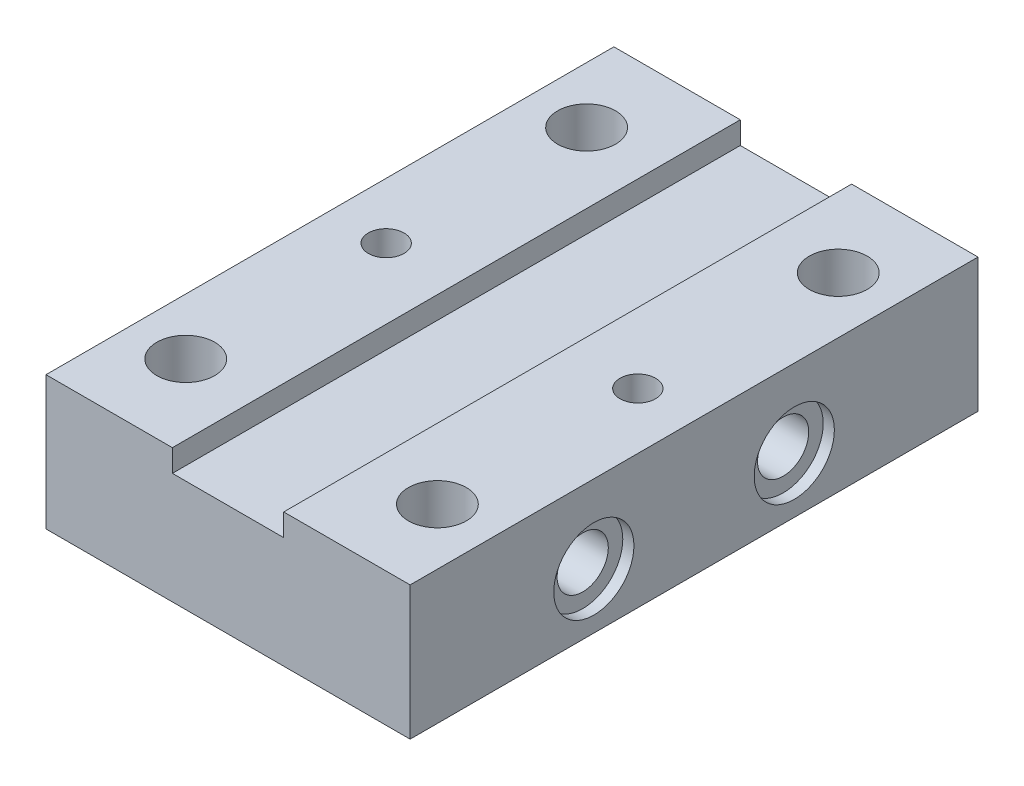
from build123d import *

# Parameters (mm, degrees)
SKETCH_1_W          = 32.7
SKETCH_1_H          = 51
EXTRUDE_1_DEPTH     = 12
SKETCH_2_R          = 2.6
SKETCH_2_R_2        = 1.6
CUT_EXTRUDE_1_DEPTH = 33.581781719
SKETCH_3_W          = 10
SKETCH_3_H          = 2
CUT_EXTRUDE_2_DEPTH = 55.884628996


# Read off the part's stored shape, not the designer's step: 高级异型孔1
with BuildPart() as part:
    # 草图1 → 凸台-拉伸1 (new body)
    with BuildSketch(Plane(origin=(0, 0, 0), x_dir=(1, 0, 0), z_dir=(0, 1, 0))):
        Rectangle(SKETCH_1_W, SKETCH_1_H)
    extrude(amount=EXTRUDE_1_DEPTH)

    # 草图2 → 切除-拉伸1 (cut, through all)
    with BuildSketch(Plane(origin=(0, 12, 0), x_dir=(1, 0, 0), z_dir=(0, 1, 0))):
        with Locations(Location((-11.3, 18, 0), (0, 0, 270))):
            Circle(SKETCH_2_R)
        with Locations(Location((11.3, 18, 0), (0, 0, 90))):
            Circle(SKETCH_2_R)
        with Locations(Location((11.3, -18, 0), (0, 0, 270))):
            Circle(SKETCH_2_R)
        with Locations(Location((-11.3, -18, 0), (0, 0, 90))):
            Circle(SKETCH_2_R)
        with Locations(Location((11.3, 0, 0), (0, 0, 270))):
            Circle(SKETCH_2_R_2)
        with Locations(Location((-11.3, 0, 0), (0, 0, 90))):
            Circle(SKETCH_2_R_2)
    extrude(amount=-CUT_EXTRUDE_1_DEPTH, mode=Mode.SUBTRACT)

    # 草图3 → 切除-拉伸2 (cut, through all)
    with BuildSketch(Plane.XY.offset(25.5)):
        with Locations((0, 11)):
            Rectangle(SKETCH_3_W, SKETCH_3_H)
    extrude(amount=-CUT_EXTRUDE_2_DEPTH, mode=Mode.SUBTRACT)

    # 高级异型孔1 outline → 高级异型孔1 (revolve, cut)
    with BuildSketch(Plane(origin=(0, 5, 9), x_dir=(0, 1, 0), z_dir=(0, 0, -1))):
        Polygon((3.6, -16.35), (3.6, -15.35), (2.3, -15.35), (2.3, -5.35), (0, -3.96802058), (0, -16.35), align=None)
    other_1 = revolve(axis=Axis((0, 5, 9), (1, 0, 0)), mode=Mode.SUBTRACT)

    # Other 1 2 outline → Other 1 2 (revolve, cut)
    with BuildSketch(Plane(origin=(0, 5, -9), x_dir=(0, 1, 0), z_dir=(0, 0, -1))):
        Polygon((0, -16.35), (3.6, -16.35), (3.6, -15.35), (2.3, -15.35), (2.3, -5.35), (0, -3.96802058), align=None)
    other_1_2 = revolve(axis=Axis((0, 5, -9), (1, 0, 0)), mode=Mode.SUBTRACT)

    # 镜向1: 高级异型孔1, Other 1 2 across plane
    add(other_1.mirror(Plane(origin=(0, 0, 0), x_dir=(0, 0, 1), z_dir=(1, 0, 0))), mode=Mode.SUBTRACT)
    add(other_1_2.mirror(Plane(origin=(0, 0, 0), x_dir=(0, 0, 1), z_dir=(1, 0, 0))), mode=Mode.SUBTRACT)


solid = part.part
